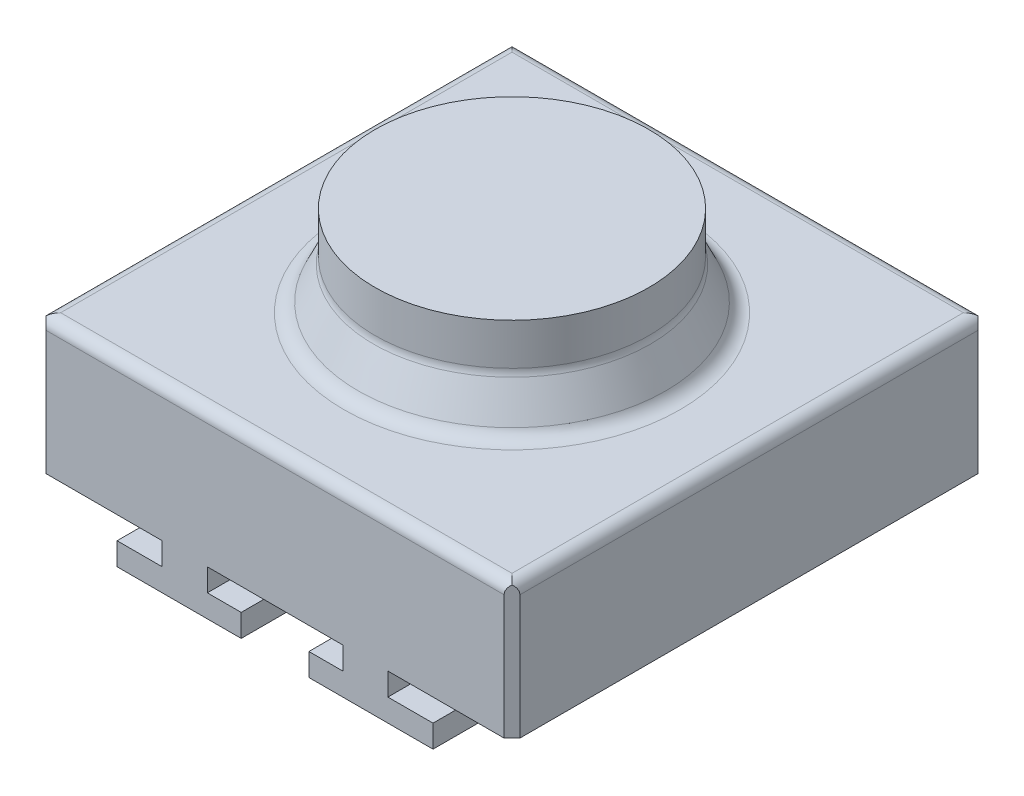
from build123d import *

# Parameters (mm, degrees)
BOSS_EXTRUDE1_DEPTH = 210
SKETCH3_R           = 70
BOSS_EXTRUDE2_DEPTH = 20
BOSS_EXTRUDE2_TAPER = 25
SKETCH4_R           = 60.673846837
BOSS_EXTRUDE3_DEPTH = 20
CHAMFER1_SIZE       = 3.5
FILLET1_R           = 7
FILLET2_R           = 5


with BuildPart() as part:
    # Sketch2 → Boss-Extrude1 (new body)
    with BuildSketch(Plane.XY):
        Polygon((0, 0), (55, 0), (55, 10), (40, 10), (40, 20), (100, 20), (100, 10), (85, 10), (85, 0), (140, 0), (140, 10), (120, 10), (120, 20), (175, 20), (175, 80), (-35, 80), (-35, 20), (20, 20), (20, 10), (0, 10), align=None)
    extrude(amount=BOSS_EXTRUDE1_DEPTH)

    # Sketch3 → Boss-Extrude2 (add)
    with BuildSketch(Plane(origin=(0, 80, 0), x_dir=(1, 0, 0), z_dir=(0, 1, 0))):
        with Locations((70, -105)):
            Circle(SKETCH3_R)
    extrude(amount=BOSS_EXTRUDE2_DEPTH, taper=BOSS_EXTRUDE2_TAPER)

    # Sketch4 → Boss-Extrude3 (add)
    with BuildSketch(Plane(origin=(0, 100, 0), x_dir=(1, 0, 0), z_dir=(0, 1, 0))):
        with Locations(Location((70, -105, 0), (0, 0, 180))):
            Circle(SKETCH4_R)
    extrude(amount=BOSS_EXTRUDE3_DEPTH)

    # Chamfer1
    chamfer1_edges = [part.edges().sort_by_distance(p)[0] for p in [
        (-35, 50, 0),
        (175, 50, 0),
        (175, 50, 210),
        (-35, 50, 210),
    ]]
    chamfer(chamfer1_edges, length=CHAMFER1_SIZE)

    # Fillet1
    fillet1_edges = [part.edges().sort_by_distance(p)[0] for p in [
        (0, 80, 105),
        (70, 100, 44.326153163),
    ]]
    fillet(fillet1_edges, radius=FILLET1_R)

    # Fillet2
    # the kernel refuses this fillet: 5 mm, written as the material it takes off along each edge
    with BuildSketch(Plane(origin=(-35, 80, -9), x_dir=(1, 0, 0), z_dir=(0, 0, 1)), Plane(origin=(184, 80, 0), x_dir=(0, 0, 1), z_dir=(-1, 0, 0))) as fillet2_piece_1:
        with BuildLine():
            CenterArc((FILLET2_R, -FILLET2_R), FILLET2_R, 90, 90)
            Line((0, -FILLET2_R), (0, 0))
            Line((0, 0), (FILLET2_R, 0))
        make_face()
    extrude(amount=228, mode=Mode.SUBTRACT)
    with BuildSketch(Plane(origin=(175, 80, -9), x_dir=(-1, 0, 0), z_dir=(0, 0, 1)), Plane(origin=(184, 80, 210), x_dir=(0, 0, -1), z_dir=(-1, 0, 0))) as fillet2_piece_2:
        with BuildLine():
            CenterArc((FILLET2_R, FILLET2_R), FILLET2_R, 180, 90)
            Line((0, FILLET2_R), (0, 0))
            Line((0, 0), (FILLET2_R, 0))
        make_face()
    extrude(amount=228, mode=Mode.SUBTRACT)


solid = part.part
